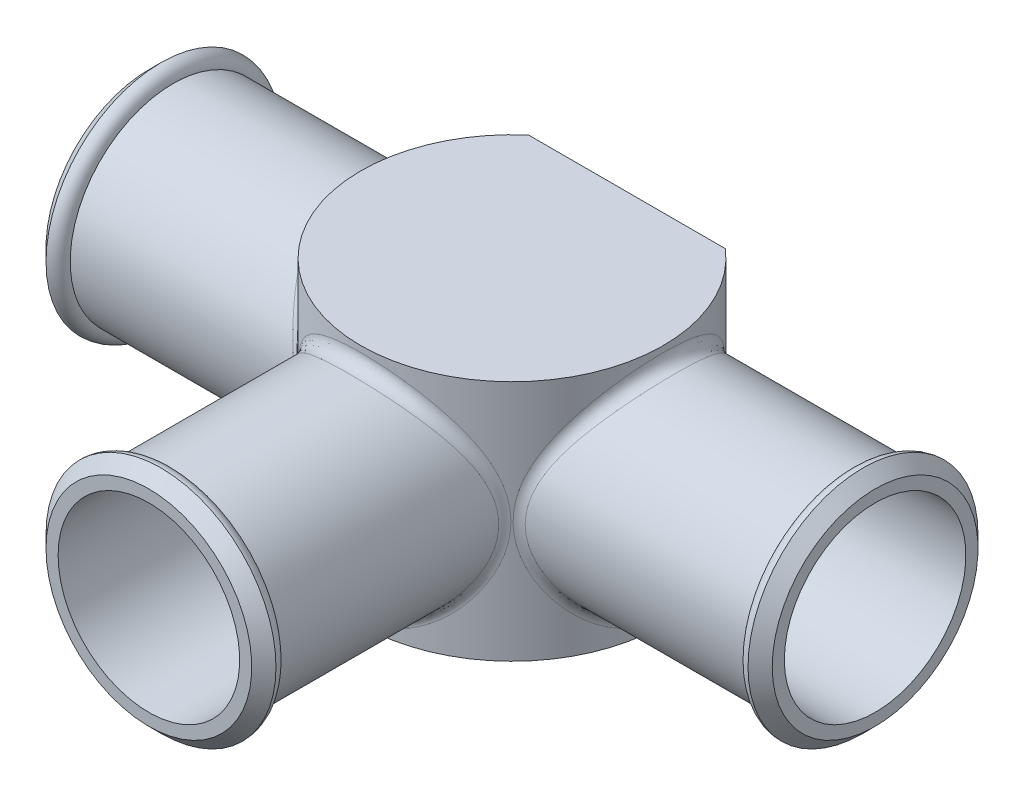
from build123d import *
from build123d.topology import SkipClean

# Parameters (mm, degrees)
BOSS_EXTRUDE1_DEPTH     = 25.4
CUT_SWEEP1_PROFILE_R    = 9.525
CIRPATTERN1_COUNT       = 3
CIRPATTERN1_ANGLE       = 180
CUT_EXTRUDE2_DEPTH      = 60.56828032
CUT_EXTRUDE2_DEPTH_BACK = 60.56828032
CUT_EXTRUDE3_DEPTH      = 60.56828032
CHAMFER1_SIZE           = 1.27
FILLET1_R               = 1.27


with BuildPart() as part:
    # Sketch1 → Boss-Extrude1 (new body)
    with BuildSketch(Plane(origin=(0, 0, 0), x_dir=(1, 0, 0), z_dir=(0, 1, 0))):
        with BuildLine():
            Line((10.317528774, 12.065), (-10.317528774, 12.065))
            ThreePointArc((-10.317528774, 12.065), (-6.641718743, -14.418848676), (15.875, 0))
            ThreePointArc((15.875, 0), (14.418848676, 6.641718743), (10.317528774, 12.065))
        make_face()
    extrude(amount=BOSS_EXTRUDE1_DEPTH)

    # Cut-Sweep1: sweep along a path in Sketch3
    with BuildLine(Plane.XY) as cut_sweep1_path:
        Line((0, 12.7), (41.275, 12.7))
    # Cut-Sweep1 profile (on start of the path) → Cut-Sweep1 (sweep, cut)
    with BuildSketch(Plane(origin=(0, 12.7, 0), x_dir=(0, 1, 0), z_dir=(1, 0, 0))):
        Circle(CUT_SWEEP1_PROFILE_R)
    cut_sweep1 = sweep(path=cut_sweep1_path.line, mode=Mode.SUBTRACT)

    # Sketch10 → Revolve1 (revolve)
    with BuildSketch(Plane.XY, mode=Mode.PRIVATE) as revolve1_sk:
        Polygon((0, 22.225), (38.1, 22.225), (38.1, 24.765), (35.56, 24.765), (35.56, 23.495), (0, 23.495), align=None)
    revolve1 = revolve(revolve1_sk.sketch.rotate(Axis((0, 12.7, 0), (1, 0, 0)), 90), axis=Axis((0, 12.7, 0), (1, 0, 0)))

    # CirPattern1: Cut-Sweep1, Revolve1 ×3 about axis
    cirpattern1_axis = Axis((0, 0, 0), (0, -1, 0))
    add([cut_sweep1.rotate(cirpattern1_axis, i * CIRPATTERN1_ANGLE / (CIRPATTERN1_COUNT - 1)) for i in range(1, CIRPATTERN1_COUNT)], mode=Mode.SUBTRACT)
    add([revolve1.rotate(cirpattern1_axis, i * CIRPATTERN1_ANGLE / (CIRPATTERN1_COUNT - 1)) for i in range(1, CIRPATTERN1_COUNT)])

    # Sketch20 → Cut-Extrude2 (cut, two sides: drawn at the far end of the back side and taken through both)
    with SkipClean():  # the faces are left unmerged after this step: merging them gives an invalid solid
        with BuildSketch(Plane(origin=(0, 0, 0), x_dir=(0, 0, -1), z_dir=(1, 0, 0)).offset(-CUT_EXTRUDE2_DEPTH_BACK)):
            with BuildLine():
                Line((0, 3.175), (0, 22.225))
                ThreePointArc((0, 22.225), (-9.525, 12.7), (0, 3.175))
            make_face()
        extrude(amount=CUT_EXTRUDE2_DEPTH + CUT_EXTRUDE2_DEPTH_BACK, mode=Mode.SUBTRACT)
    add(part.part.scale(1), mode=Mode.REPLACE)  # the faces are merged on a copy

    # Sketch23 → Cut-Extrude3 (cut, through all)
    with BuildSketch(Plane.XY):
        with BuildLine():
            Line((0, 3.175), (0, 22.225))
            ThreePointArc((0, 22.225), (-9.525, 12.7), (0, 3.175))
        make_face()
    extrude(amount=CUT_EXTRUDE3_DEPTH, mode=Mode.SUBTRACT)

    # Chamfer1
    chamfer1_edges = [part.edges().sort_by_distance(p)[0] for p in [
        (38.1, 12.7, -12.065),
        (12.065, 12.7, 38.1),
        (-38.1, 12.7, 12.065),
    ]]
    chamfer(chamfer1_edges, length=CHAMFER1_SIZE)

    # Fillet1
    fillet1_edges = [part.edges().sort_by_distance(p)[0] for p in [
        (11.639982552, 12.774791783, -10.794740904),
        (35.56, 12.7, -12.065),
        (10.794949616, 12.667018292, 11.639788993),
        (12.065, 12.7, 35.56),
        (-11.639779227, 12.670666372, 10.794960146),
        (-35.56, 12.7, 12.065),
    ]]
    fillet(fillet1_edges, radius=FILLET1_R - 0.0001)  # a hair under: the kernel refuses the full size


solid = part.part
